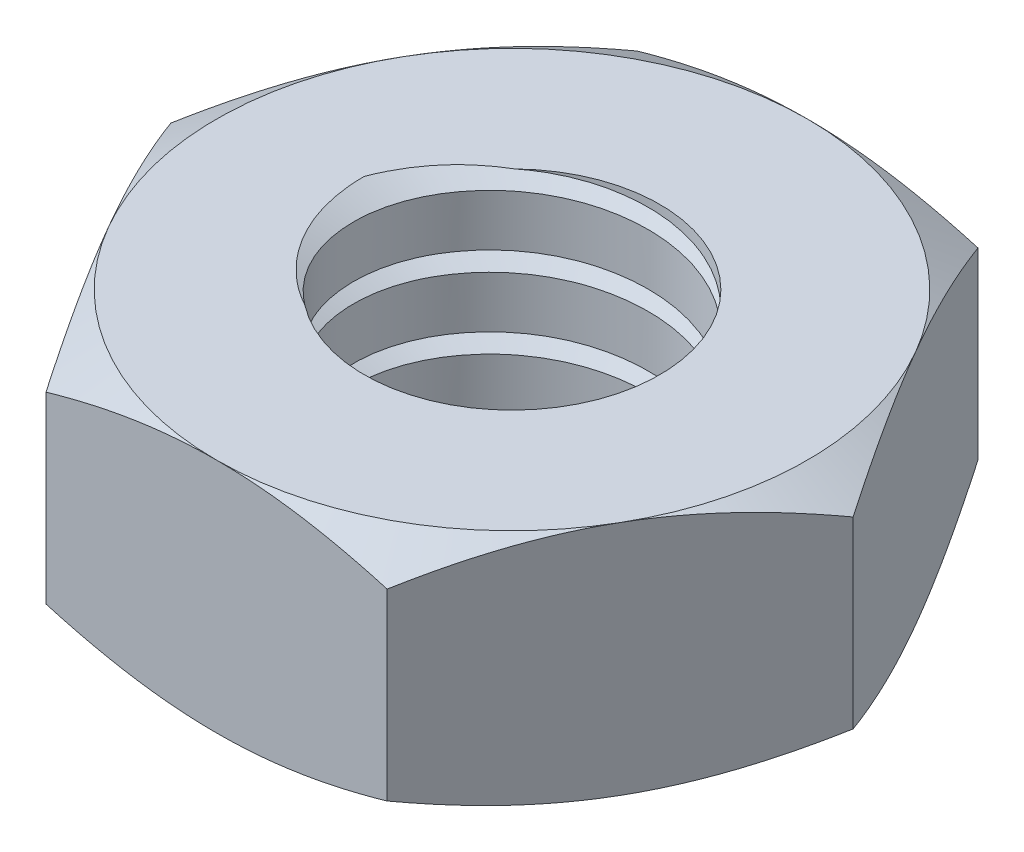
from build123d import *

# Parameters (mm, degrees)
BOSS_EXTRUDE1_DEPTH       = 4
SKETCH2_R                 = 7.745439451
SKETCH2_R_2               = 5
CUT_EXTRUDE3_DEPTH        = 0.5
CUT_EXTRUDE3_DRAFT        = -60
MIRROR1_COPY_1_SKETCH_R   = 7.745439451
MIRROR1_COPY_1_SKETCH_R_2 = 5
MIRROR1_COPY_1_DEPTH      = 0.5
MIRROR1_COPY_1_DRAFT      = -60
SKETCH3_R                 = 2.5
CUT_EXTRUDE4_DEPTH        = 7.5
CUT_SWEEP1_PITCH          = 1.2


with BuildPart() as part:
    # Sketch1 → Boss-Extrude1 (new body)
    with BuildSketch(Plane(origin=(0, 0, 0), x_dir=(1, 0, 0), z_dir=(0, 1, 0))):
        Polygon((5.773502692, 0), (2.886751346, 5), (-2.886751346, 5), (-5.773502692, 0), (-2.886751346, -5), (2.886751346, -5), align=None)
    extrude(amount=BOSS_EXTRUDE1_DEPTH)


with BuildPart() as cut_extrude3_tool:
    # Sketch2 → Cut-Extrude3 (with draft: the straight prism first)
    with BuildSketch(Plane(origin=(0, 4, 0), x_dir=(1, 0, 0), z_dir=(0, 1, 0))):
        Circle(SKETCH2_R)
        Circle(SKETCH2_R_2, mode=Mode.SUBTRACT)
    extrude(amount=-CUT_EXTRUDE3_DEPTH)
    # Cut-Extrude3: the draft: its side faces are tilted about the plane it starts from
    cut_extrude3_sides = [cut_extrude3_tool.faces().sort_by_distance(p)[0] for p in [
        (-7.745439451, 3.75, 0),
        (-5, 3.75, 0),
    ]]
    draft(cut_extrude3_sides, Plane(origin=(0, 4, 0), x_dir=(1, 0, 0), z_dir=(0, 1, 0)), CUT_EXTRUDE3_DRAFT)


with BuildPart() as part_1:
    add(part.part)

    # Cut-Extrude3: cut by cut_extrude3_tool
    add(cut_extrude3_tool.part, mode=Mode.SUBTRACT)


with BuildPart() as mirror1_copy_1_tool:
    # Mirror1 copy 1 sketch → Mirror1 copy 1 (with draft: the straight prism first)
    with BuildSketch(Plane.XZ):
        Circle(MIRROR1_COPY_1_SKETCH_R)
        Circle(MIRROR1_COPY_1_SKETCH_R_2, mode=Mode.SUBTRACT)
    extrude(amount=-MIRROR1_COPY_1_DEPTH)
    # Mirror1 copy 1: the draft: its side faces are tilted about the plane it starts from
    mirror1_copy_1_sides = [mirror1_copy_1_tool.faces().sort_by_distance(p)[0] for p in [
        (-7.745439451, 0.25, 0),
        (-5, 0.25, 0),
    ]]
    draft(mirror1_copy_1_sides, Plane.XZ, MIRROR1_COPY_1_DRAFT)


with BuildPart() as part_2:
    add(part_1.part)

    # Mirror1 copy 1: cut by mirror1_copy_1_tool
    add(mirror1_copy_1_tool.part, mode=Mode.SUBTRACT)

    # Sketch3 → Cut-Extrude4 (cut)
    with BuildSketch(Plane(origin=(0, 4, 0), x_dir=(1, 0, 0), z_dir=(0, 1, 0))):
        with Locations(Location((0, 0, 0), (0, 0, 270))):
            Circle(SKETCH3_R)
    extrude(amount=-CUT_EXTRUDE4_DEPTH, mode=Mode.SUBTRACT)

    # Cut-Sweep1: the profile of Sketch5 screwed along a right-hand helix of 15 turns, 8 arcs to a turn; built about Z, then put on its axis
    cut_sweep1_z = Axis((0, 0, 0), (0, 0, 1))
    cut_sweep1_corners = [(2.486109611, 0, 0.019996905), (2.486109611, 0, 0.356686008), (2.937039392, 0, 0.225761668)]
    with BuildLine(mode=Mode.PRIVATE) as cut_sweep1_profile:
        Line(cut_sweep1_corners[0], cut_sweep1_corners[1])
        Line(cut_sweep1_corners[1], cut_sweep1_corners[2])
        Line(cut_sweep1_corners[2], cut_sweep1_corners[0])
    cut_sweep1_cap = Face(cut_sweep1_profile.wire())
    cut_sweep1_turn_angles = [0, 22.5, 45, 67.5, 90, 112.5, 135, 157.5, 180, 202.5, 225, 247.5, 270, 292.5, 315, 337.5, 360]
    cut_sweep1_turn_weights = [1, 0.9238795325112867, 1, 0.9238795325112867, 1, 0.9238795325112867, 1, 0.9238795325112867, 1, 0.9238795325112867, 1, 0.9238795325112867, 1, 0.9238795325112867, 1, 0.9238795325112867, 1]
    cut_sweep1_turn_rails = [Edge.make_bspline([Vector(p[0], p[1], 0).rotate(cut_sweep1_z, cut_sweep1_turn_angles[k]) / cut_sweep1_turn_weights[k] + Vector(0, 0, p[2] + CUT_SWEEP1_PITCH * cut_sweep1_turn_angles[k] / 360) for k in range(17)], [0, 0, 0, 1, 1, 2, 2, 3, 3, 4, 4, 5, 5, 6, 6, 7, 7, 8, 8, 8], 2, cut_sweep1_turn_weights) for p in cut_sweep1_corners]
    cut_sweep1_turn_sides = [Face.make_surface_from_curves(cut_sweep1_turn_rails[p[0]], cut_sweep1_turn_rails[p[1]]) for p in [(0, 1), (1, 2), (2, 0)]]
    cut_sweep1 = Plane(origin=(0, -1, 0), x_dir=(-1, 0, 0), z_dir=(0, 1, 0)) * Solid(Shell([*[p.moved(Location((0, 0, CUT_SWEEP1_PITCH * i))) for i in range(15) for p in cut_sweep1_turn_sides], cut_sweep1_cap, cut_sweep1_cap.rotate(cut_sweep1_z, 5400).moved(Location((0, 0, CUT_SWEEP1_PITCH * 5400 / 360)))]))
    add(cut_sweep1, mode=Mode.SUBTRACT)


solid = part_2.part
